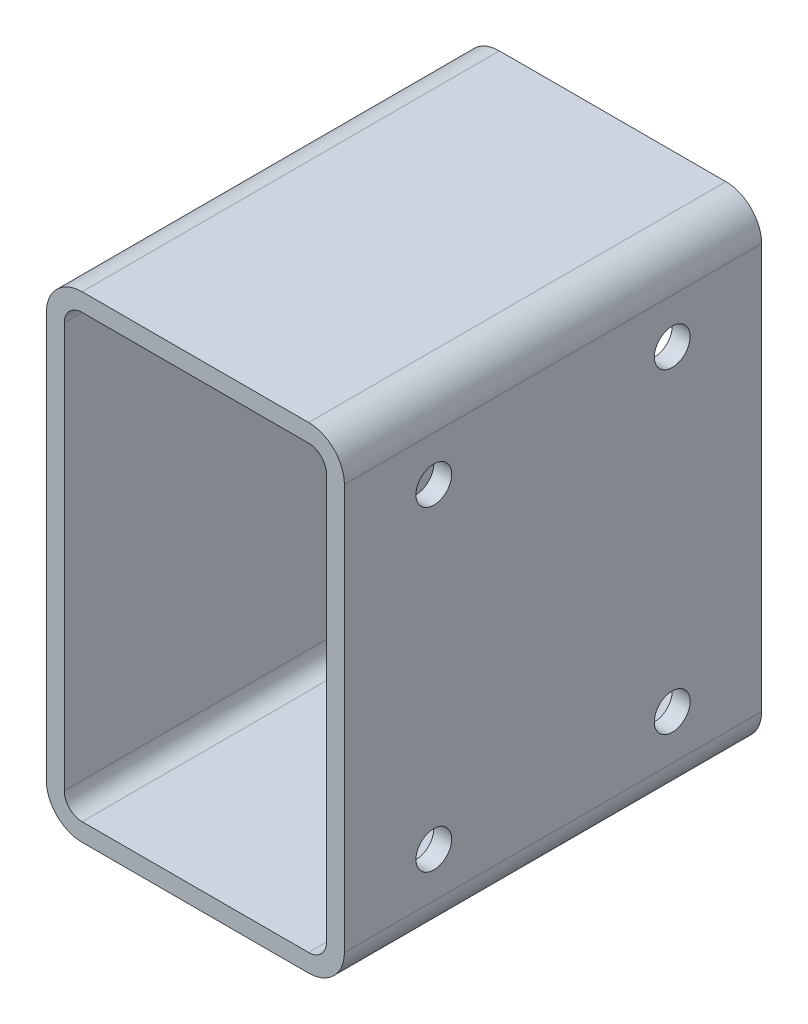
from build123d import *

# Parameters (mm, degrees)
BOSS_EXTRUDE1_DEPTH = 35
SKETCH2_R           = 3
CUT_EXTRUDE1_DEPTH  = 10


with BuildPart() as part:
    # Sketch1 → Boss-Extrude1 (new, symmetric)
    with BuildSketch(Plane.XY):
        with BuildLine():
            Line((19, -40), (-19, -40))
            ThreePointArc((-19, -40), (-23.242640687, -38.242640687), (-25, -34))
            Line((-25, -34), (-25, 34))
            ThreePointArc((-25, 34), (-23.242640687, 38.242640687), (-19, 40))
            Line((-19, 40), (19, 40))
            ThreePointArc((19, 40), (23.242640687, 38.242640687), (25, 34))
            Line((25, 34), (25, -34))
            ThreePointArc((25, -34), (23.242640687, -38.242640687), (19, -40))
        make_face()
        with BuildLine():
            Line((19, 37), (-19, 37))
            ThreePointArc((-19, 37), (-21.121320344, 36.121320344), (-22, 34))
            Line((-22, 34), (-22, -34))
            ThreePointArc((-22, -34), (-21.121320344, -36.121320344), (-19, -37))
            Line((-19, -37), (19, -37))
            ThreePointArc((19, -37), (21.121320344, -36.121320344), (22, -34))
            Line((22, -34), (22, 34))
            ThreePointArc((22, 34), (21.121320344, 36.121320344), (19, 37))
        make_face(mode=Mode.SUBTRACT)
    extrude(amount=BOSS_EXTRUDE1_DEPTH, both=True)

    # Sketch2 → Cut-Extrude1 (cut)
    with BuildSketch(Plane(origin=(25, 0, 0), x_dir=(0, 0, -1), z_dir=(1, 0, 0))):
        with Locations((-20, 26.5)):
            Circle(SKETCH2_R)
        with Locations((20, 26.5)):
            Circle(SKETCH2_R)
        with Locations((20, -26.5)):
            Circle(SKETCH2_R)
        with Locations((-20, -26.5)):
            Circle(SKETCH2_R)
    extrude(amount=-CUT_EXTRUDE1_DEPTH, mode=Mode.SUBTRACT)


solid = part.part
